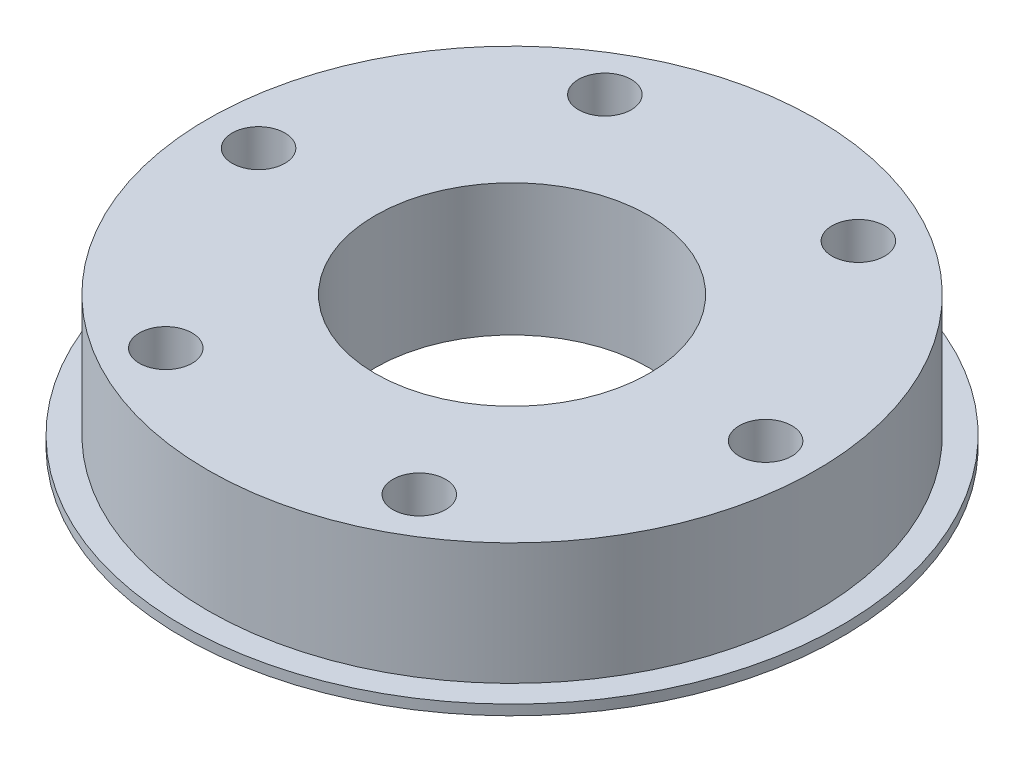
from build123d import *

# Parameters (mm, degrees)
SKETCH1_R           = 30
BOSS_EXTRUDE1_DEPTH = 13
SKETCH2_R           = 32.5
BOSS_EXTRUDE2_DEPTH = 1
SKETCH3_R           = 1.6
CUT_EXTRUDE1_DEPTH  = 3.5
SKETCH4_R           = 13.5
CUT_EXTRUDE2_DEPTH  = 51
SKETCH5_R           = 2.6
CUT_EXTRUDE3_DEPTH  = 25


with BuildPart() as part:
    # Sketch1 → Boss-Extrude1 (new body)
    with BuildSketch(Plane(origin=(0, 0, 0), x_dir=(1, 0, 0), z_dir=(0, 1, 0))):
        Circle(SKETCH1_R)
    extrude(amount=BOSS_EXTRUDE1_DEPTH)

    # Sketch2 → Boss-Extrude2 (add)
    with BuildSketch(Plane.XZ):
        Circle(SKETCH2_R)
    extrude(amount=-BOSS_EXTRUDE2_DEPTH)

    # Sketch3 → Cut-Extrude1 (cut)
    with BuildSketch(Plane(origin=(0, 0, 0), x_dir=(1, 0, 0), z_dir=(0, 1, 0))):
        with Locations((0, 25)):
            Circle(SKETCH3_R)
        with Locations((21.650635095, 12.5)):
            Circle(SKETCH3_R)
        with Locations((21.650635095, -12.5)):
            Circle(SKETCH3_R)
        with Locations((0, -25)):
            Circle(SKETCH3_R)
        with Locations((-21.650635095, -12.5)):
            Circle(SKETCH3_R)
        with Locations((-21.650635095, 12.5)):
            Circle(SKETCH3_R)
    extrude(amount=CUT_EXTRUDE1_DEPTH, mode=Mode.SUBTRACT)

    # Sketch4 → Cut-Extrude2 (cut)
    with BuildSketch(Plane.XZ):
        Circle(SKETCH4_R)
    extrude(amount=-CUT_EXTRUDE2_DEPTH, mode=Mode.SUBTRACT)

    # Sketch5 → Cut-Extrude3 (cut)
    with BuildSketch(Plane.XZ):
        with Locations((-12.5, 21.650635095)):
            Circle(SKETCH5_R)
        with Locations((12.5, 21.650635095)):
            Circle(SKETCH5_R)
        with Locations((25, 0)):
            Circle(SKETCH5_R)
        with Locations((12.5, -21.650635095)):
            Circle(SKETCH5_R)
        with Locations((-12.5, -21.650635095)):
            Circle(SKETCH5_R)
        with Locations((-25, 0)):
            Circle(SKETCH5_R)
    extrude(amount=-CUT_EXTRUDE3_DEPTH, mode=Mode.SUBTRACT)


solid = part.part
